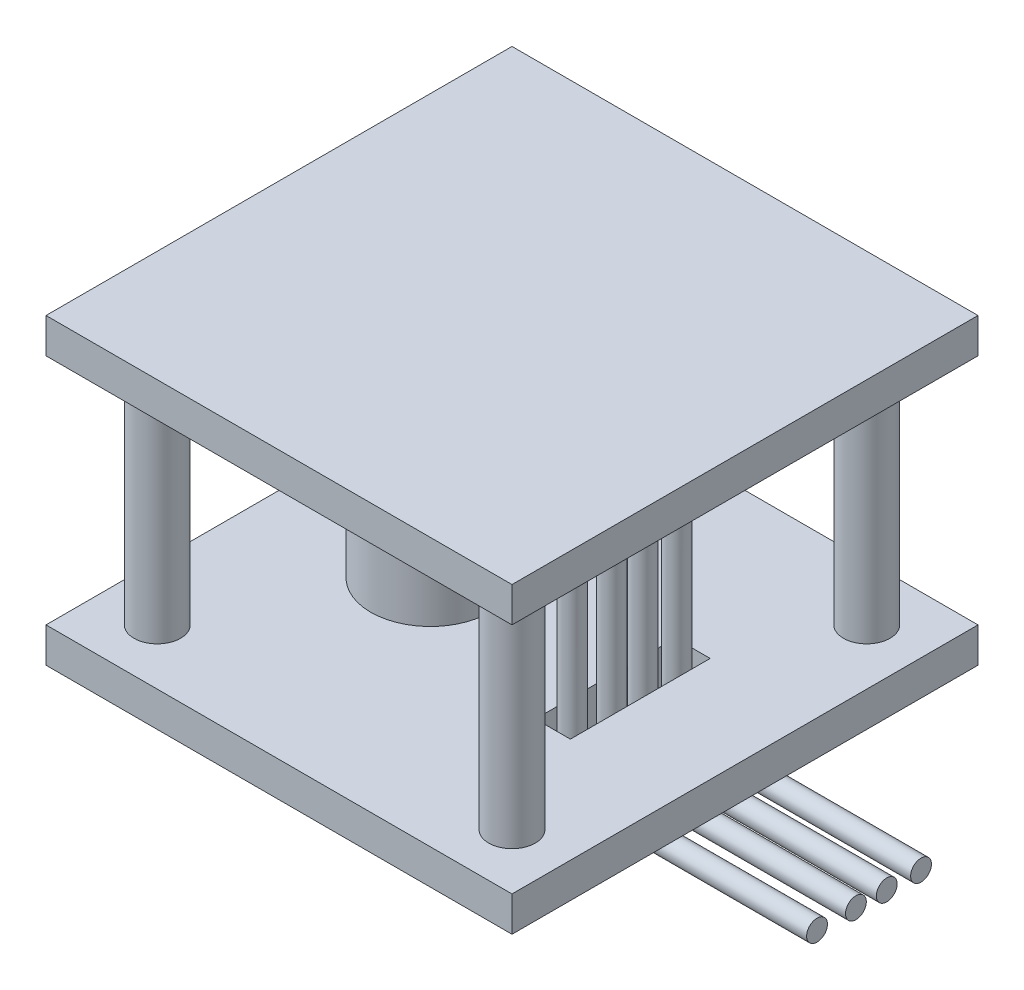
from build123d import *

# Parameters (mm, degrees)
SKETCH_2_W           = 40
SKETCH_2_H           = 40
EXTRUDE_2_DEPTH      = 3
SKETCH_3_R           = 2
SKETCH_3_R_2         = 5.125
SKETCH_3_W           = 3
SKETCH_3_H           = 12
CUT_EXTRUDE_1_DEPTH  = 3
SKETCH_4_R           = 2
EXTRUDE_3_DEPTH      = 2
EXTRUDE_START        = 20
SKETCH_9_W           = 40
SKETCH_9_H           = 40
EXTRUDE_4_DEPTH      = 3
SKETCH_3_3_R         = 2
EXTRUDE_5_DEPTH      = 24
EXTRUDE_START_2      = -2
SKETCH_2_8_R         = 2
EXTRUDE_6_DEPTH      = 2
SKETCH_11_W          = 28.649920568
SKETCH_11_H          = 15.870303346
EXTRUDE_7_DEPTH      = 2
EXTRUDE_8_DEPTH      = 18
EXTRUDE_8_DEPTH_BACK = 5
SKETCH_12_R          = 5.125
SKETCH_13_W          = 3
SKETCH_13_H          = 12
EXTRUDE_9_DEPTH      = 3
SKETCH_14_R          = 0.926290341
EXTRUDE_10_DEPTH     = 21
EXTRUDE_START_3      = 9.5
SKETCH_16_R          = 0.89368598
EXTRUDE_11_DEPTH     = 21


with BuildPart() as part:
    # 草图2 → 凸台-拉伸2 (new body)
    with BuildSketch(Plane(origin=(0, 0, 0), x_dir=(1, 0, 0), z_dir=(0, 1, 0))):
        Rectangle(SKETCH_2_W, SKETCH_2_H)
    extrude(amount=EXTRUDE_2_DEPTH)

    # 草图3 → 切除-拉伸1 (cut)
    with BuildSketch(Plane(origin=(0, 0, 0), x_dir=(1, 0, 0), z_dir=(0, 1, 0))):
        with Locations((-15.224798987, -15.224798987)):
            Circle(SKETCH_3_R)
        with Locations((15.224798987, -15.224798987)):
            Circle(SKETCH_3_R)
        with Locations((15.224798987, 15.224798987)):
            Circle(SKETCH_3_R)
        with Locations((-15.224798987, 15.224798987)):
            Circle(SKETCH_3_R)
        with Locations((-7, 0)):
            Circle(SKETCH_3_R_2)
        with Locations((9.5, 0.011605537)):
            Rectangle(SKETCH_3_W, SKETCH_3_H)
    extrude(amount=CUT_EXTRUDE_1_DEPTH, mode=Mode.SUBTRACT)

    # 草图4 → 凸台-拉伸3 (add)
    with BuildSketch(Plane(origin=(0, 0, 0), x_dir=(1, 0, 0), z_dir=(0, 1, 0))):
        with Locations((3, 0)):
            Circle(SKETCH_4_R)
    extrude(amount=-EXTRUDE_3_DEPTH)



with BuildPart() as body_2:
    # 草图9 → 凸台-拉伸4 (new body)
    with BuildSketch(Plane(origin=(0, 3, 0), x_dir=(1, 0, 0), z_dir=(0, 1, 0)).offset(EXTRUDE_START)):
        Rectangle(SKETCH_9_W, SKETCH_9_H)
    extrude(amount=EXTRUDE_4_DEPTH)

    # 草图3<3> → 凸台-拉伸5 (add)
    with BuildSketch(Plane(origin=(0, 0, 0), x_dir=(1, 0, 0), z_dir=(0, 1, 0))):
        with Locations((-15.224798987, -15.224798987)):
            Circle(SKETCH_3_3_R)
        with Locations((15.224798987, -15.224798987)):
            Circle(SKETCH_3_3_R)
        with Locations((15.224798987, 15.224798987)):
            Circle(SKETCH_3_3_R)
        with Locations((-15.224798987, 15.224798987)):
            Circle(SKETCH_3_3_R)
    extrude(amount=EXTRUDE_5_DEPTH)


with BuildPart() as part_1:
    add(part.part)

    add(body_2.part)  # 凸台-拉伸6 merges body 2
    # 草图2<8> → 凸台-拉伸6 (add)
    with BuildSketch(Plane(origin=(0, 0, 0), x_dir=(1, 0, 0), z_dir=(0, 1, 0)).offset(EXTRUDE_START_2)):
        with Locations((15.224798987, 15.224798987)):
            Circle(SKETCH_2_8_R)
        with Locations((-15.224798987, -15.224798987)):
            Circle(SKETCH_2_8_R)
        with Locations((15.224798987, -15.224798987)):
            Circle(SKETCH_2_8_R)
        with Locations((-15.224798987, 15.224798987)):
            Circle(SKETCH_2_8_R)
    extrude(amount=EXTRUDE_6_DEPTH)

    # 草图11 → 凸台-拉伸7 (add)
    with BuildSketch(Plane.XZ.offset(-23)):
        Rectangle(SKETCH_11_W, SKETCH_11_H)
    extrude(amount=EXTRUDE_7_DEPTH)

    # 草图12 → 凸台-拉伸8 (add, two sides: drawn at the far end of the back side and taken through both)
    with BuildSketch(Plane(origin=(0, 3, 0), x_dir=(1, 0, 0), z_dir=(0, 1, 0)).offset(-EXTRUDE_8_DEPTH_BACK)):
        with Locations((-7, 0)):
            Circle(SKETCH_12_R)
    extrude(amount=EXTRUDE_8_DEPTH + EXTRUDE_8_DEPTH_BACK)

    # 草图13 → 凸台-拉伸9 (add)
    with BuildSketch(Plane.XZ.offset(-21)):
        with Locations((9.5, -0.011605537)):
            Rectangle(SKETCH_13_W, SKETCH_13_H)
    extrude(amount=EXTRUDE_9_DEPTH)

    # 草图14 → 凸台-拉伸10 (add)
    with BuildSketch(Plane.XZ.offset(-18)):
        with Locations((9.612228669, 1.034181552)):
            Circle(SKETCH_14_R)
        with Locations((9.539517293, -4.593503512)):
            Circle(SKETCH_14_R)
        with Locations((9.612228669, -1.630416094)):
            Circle(SKETCH_14_R)
        with Locations((9.539517293, 4.349326871)):
            Circle(SKETCH_14_R)
    extrude(amount=EXTRUDE_10_DEPTH)

    # 草图16 → 凸台-拉伸11 (add)
    with BuildSketch(Plane(origin=(0, 0, 0), x_dir=(0, 0, -1), z_dir=(1, 0, 0)).offset(EXTRUDE_START_3)):
        with Locations((-4.31672251, -2.284079834)):
            Circle(SKETCH_16_R)
        with Locations((-0.981073298, -2.284079834)):
            Circle(SKETCH_16_R)
        with Locations((1.667824606, -2.284079834)):
            Circle(SKETCH_16_R)
        with Locations((4.6110445, -2.284079834)):
            Circle(SKETCH_16_R)
    extrude(amount=EXTRUDE_11_DEPTH)


solid = part_1.part
